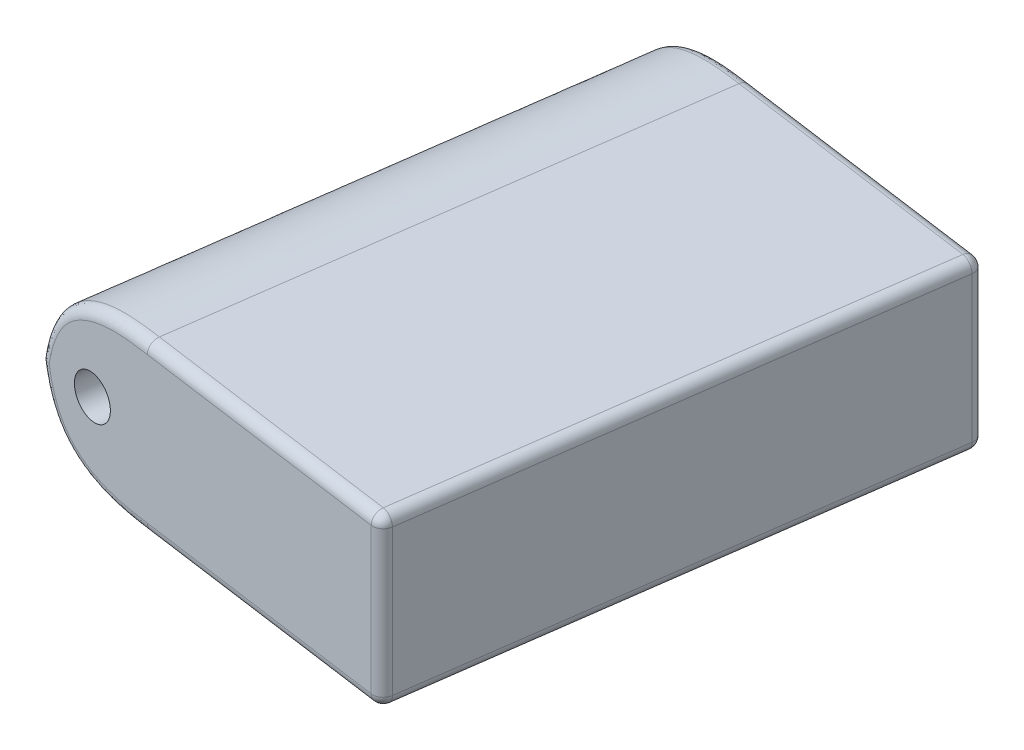
from build123d import *

# Parameters (mm, degrees)
BOSS_EXTRUDE1_DEPTH = 7.9375
SKETCH3_R           = 2.032
CUT_EXTRUDE1_DEPTH  = 2.7
SKETCH4_R           = 1.000000032
CUT_EXTRUDE2_DEPTH  = 51.71218079
FILLET2_SIZE        = 6.096
FILLET3_R           = 0.508


with BuildPart() as part:
    # Sketch1 → Boss-Extrude1 (new body)
    with BuildSketch(Plane(origin=(0, 0, 0), x_dir=(1, 0, 0), z_dir=(0, 1, 0))):
        Polygon((-27.422743224, -19.119856123), (-46.29298428, -16.509012872), (-42.811859946, 8.651308536), (-23.941618889, 6.040465285), align=None)
    extrude(amount=BOSS_EXTRUDE1_DEPTH)

    # Sketch3 → Cut-Extrude1 (cut)
    with BuildSketch(Plane(origin=(0.316670388, 0, -2.684144047), x_dir=(-0.9905638349724136, 0, -0.13705213914691383), z_dir=(0.13705213914691383, 0, -0.9905638349724136))):
        with Locations((40.495544979, 3.96875)):
            Circle(SKETCH3_R)
    extrude(amount=-CUT_EXTRUDE1_DEPTH, mode=Mode.SUBTRACT)

    # Sketch4 → Cut-Extrude2 (cut, through all)
    with BuildSketch(Plane(origin=(0.000303759, 0, -0.00219546), x_dir=(-0.9905638349724136, 0, -0.13705213914691383), z_dir=(0.1370521391469138, 0, -0.9905638349724135))):
        with Locations((40.549730429, 3.96875)):
            Circle(SKETCH4_R)
    extrude(amount=-CUT_EXTRUDE2_DEPTH, mode=Mode.SUBTRACT)

    # Fillet2
    # a fillet whose section is not a circle: 6.096 mm, written as the material it takes off along each edge
    with BuildSketch(Plane(origin=(-48.38165888, 0, 31.605205717), x_dir=(0.9905638349724136, 0, 0.13705213914691353), z_dir=(0.13705213914691353, 0, -0.9905638349724136))) as fillet2_piece_1:
        with BuildLine():
            add(Edge.make_bspline([(FILLET2_SIZE, 0), (FILLET2_SIZE * 0.831801948466, 0), (FILLET2_SIZE * 0.663603896932, 0), (FILLET2_SIZE * 0.292893218813, -FILLET2_SIZE * 0.0716919198361), (FILLET2_SIZE * 0.0716919198361, -FILLET2_SIZE * 0.292893218813), (0, -FILLET2_SIZE * 0.663603896932), (0, -FILLET2_SIZE * 0.831801948466), (0, -FILLET2_SIZE)], knots=[0, 0, 0, 0, 0, 0, 0.5, 0.5, 1, 1, 1, 1, 1, 1], degree=5))
            Line((0, -FILLET2_SIZE), (0, 0))
            Line((0, 0), (FILLET2_SIZE, 0))
        make_face()
    extrude(amount=55.88, mode=Mode.SUBTRACT)
    with BuildSketch(Plane(origin=(-48.38165888, 7.9375, 31.605205717), x_dir=(0.9905638349724136, 0, 0.13705213914691353), z_dir=(0.13705213914691353, 0, -0.9905638349724136))) as fillet2_piece_2:
        with BuildLine():
            add(Edge.make_bspline([(FILLET2_SIZE, 0), (FILLET2_SIZE * 0.831801948466, 0), (FILLET2_SIZE * 0.663603896932, 0), (FILLET2_SIZE * 0.292893218813, FILLET2_SIZE * 0.0716919198361), (FILLET2_SIZE * 0.0716919198361, FILLET2_SIZE * 0.292893218813), (0, FILLET2_SIZE * 0.663603896932), (0, FILLET2_SIZE * 0.831801948466), (0, FILLET2_SIZE)], knots=[0, 0, 0, 0, 0, 0, 0.5, 0.5, 1, 1, 1, 1, 1, 1], degree=5))
            Line((0, FILLET2_SIZE), (0, 0))
            Line((0, 0), (FILLET2_SIZE, 0))
        make_face()
    extrude(amount=55.88, mode=Mode.SUBTRACT)

    # Fillet3
    fillet3_edges = [part.edges().sort_by_distance(p)[0] for p in [
        (-33.838625183, 7.9375, 18.232169418),
        (-33.838625183, 0, 18.232169418),
        (-25.682181057, 7.9375, 6.539695419),
        (-30.357500848, 0, -6.92815199),
        (-25.682181057, 0, 6.539695419),
        (-27.422743224, 3.96875, 19.119856123),
        (-23.941618889, 3.96875, -6.040465285),
        (-30.357500848, 7.9375, -6.92815199),
    ]]
    fillet(fillet3_edges, radius=FILLET3_R)


solid = part.part
